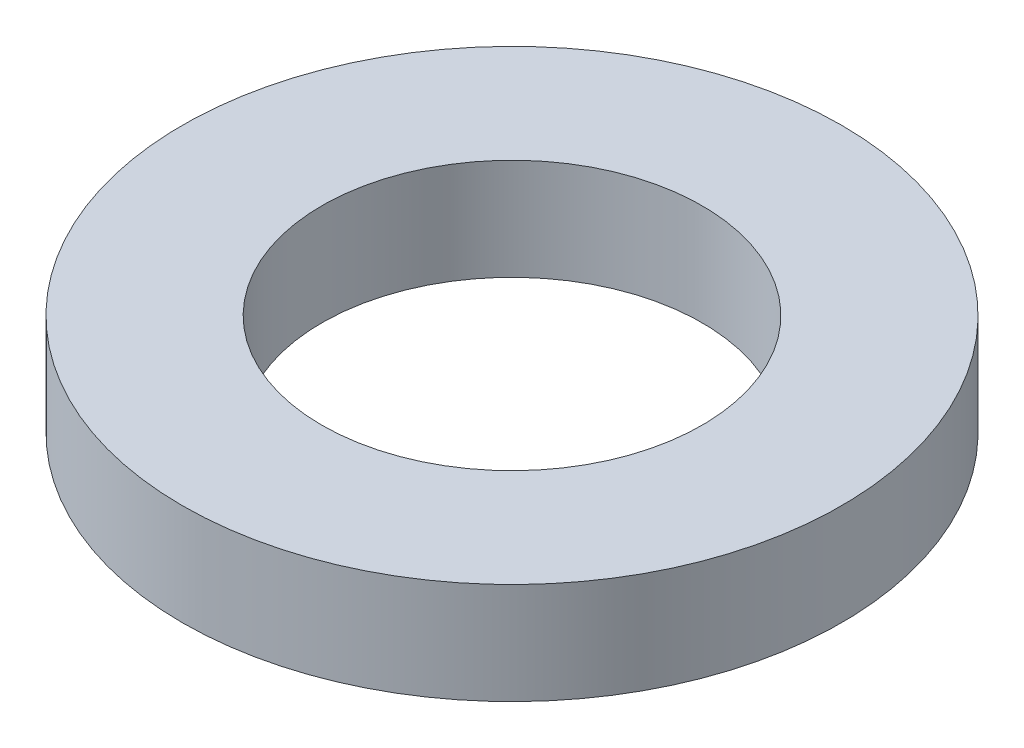
from build123d import *

# Parameters (mm, degrees)
SKETCH1_R           = 65
BOSS_EXTRUDE1_DEPTH = 20
SKETCH2_R           = 37.5
CUT_EXTRUDE1_DEPTH  = 95.074438611


with BuildPart() as part:
    # Sketch1 → Boss-Extrude1 (new body)
    with BuildSketch(Plane(origin=(0, 0, 0), x_dir=(1, 0, 0), z_dir=(0, 1, 0))):
        Circle(SKETCH1_R)
    extrude(amount=BOSS_EXTRUDE1_DEPTH)

    # Sketch2 → Cut-Extrude1 (cut, through all)
    with BuildSketch(Plane(origin=(0, 0, 0), x_dir=(1, 0, 0), z_dir=(0, 1, 0))):
        Circle(SKETCH2_R)
    extrude(amount=CUT_EXTRUDE1_DEPTH, mode=Mode.SUBTRACT)


solid = part.part
